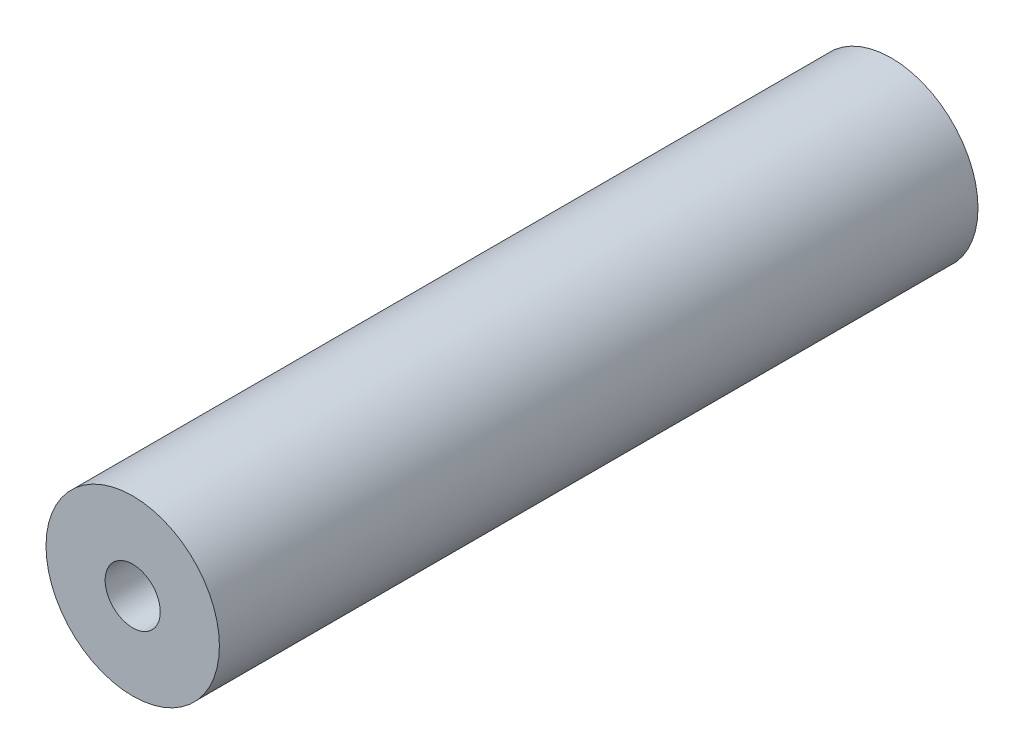
from build123d import *

# Parameters (mm, degrees)
SKETCH1_R                            = 6.35
BOSS_EXTRUDE1_DEPTH                  = 27.78125
F_10_32_TAPPED_HOLE1_D               = 4.0386
F_10_32_TAPPED_HOLE1_DEPTH           = 12.02944
F_10_32_TAPPED_HOLE1_TIP             = 1.213317848
F_10_32_TAPPED_HOLE1_ON_FACE_2_D     = 4.0386
F_10_32_TAPPED_HOLE1_ON_FACE_2_DEPTH = 12.02944
F_10_32_TAPPED_HOLE1_ON_FACE_2_TIP   = 1.213317848


with BuildPart() as part:
    # Sketch1 → Boss-Extrude1 (new, symmetric)
    with BuildSketch(Plane.XY):
        Circle(SKETCH1_R)
    extrude(amount=BOSS_EXTRUDE1_DEPTH, both=True)

    # #10-32 Tapped Hole1
    with Locations(Plane(origin=(0, 0, -27.78125), x_dir=(-1, 0, 0), z_dir=(0, 0, -1))):
        with Locations((0, 0)):
            Hole(F_10_32_TAPPED_HOLE1_D / 2, depth=F_10_32_TAPPED_HOLE1_DEPTH)
            with Locations((0, 0, -(F_10_32_TAPPED_HOLE1_DEPTH + F_10_32_TAPPED_HOLE1_TIP / 2))):  # 118° drill point
                Cone(0, F_10_32_TAPPED_HOLE1_D / 2, F_10_32_TAPPED_HOLE1_TIP, mode=Mode.SUBTRACT)

    # #10-32 Tapped Hole1 on face 2
    with Locations(Plane.XY.offset(27.78125)):
        with Locations((0, 0)):
            Hole(F_10_32_TAPPED_HOLE1_ON_FACE_2_D / 2, depth=F_10_32_TAPPED_HOLE1_ON_FACE_2_DEPTH)
            with Locations((0, 0, -(F_10_32_TAPPED_HOLE1_ON_FACE_2_DEPTH + F_10_32_TAPPED_HOLE1_ON_FACE_2_TIP / 2))):  # 118° drill point
                Cone(0, F_10_32_TAPPED_HOLE1_ON_FACE_2_D / 2, F_10_32_TAPPED_HOLE1_ON_FACE_2_TIP, mode=Mode.SUBTRACT)


solid = part.part
